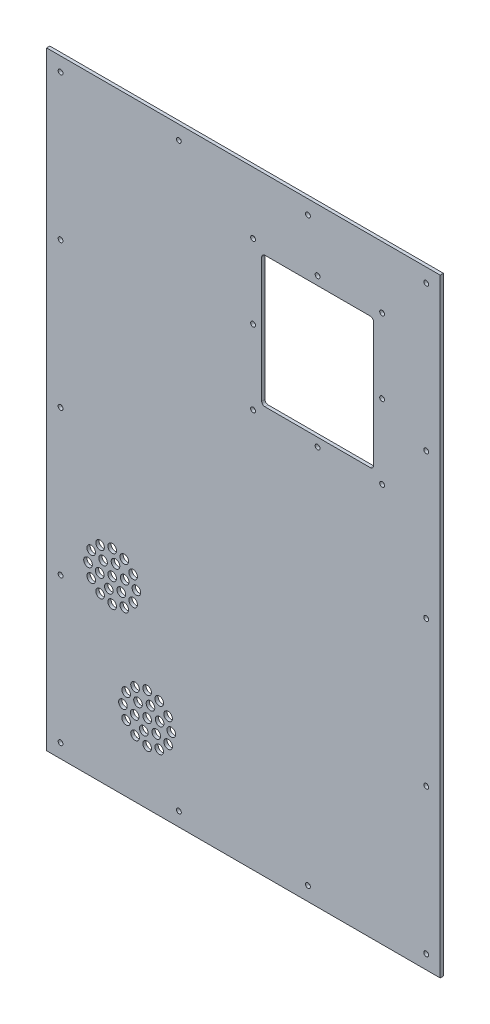
from build123d import *

# Parameters (mm, degrees)
SKETCH_1_W          = 366
SKETCH_1_H          = 566
EXTRUDE_1_DEPTH     = 3
SKETCH_5_R          = 2.25
CUT_EXTRUDE_2_DEPTH = 675.033381963
SKETCH_6_W          = 104
SKETCH_6_H          = 122
CUT_EXTRUDE_3_DEPTH = 675.033381963
SKETCH_7_R          = 2.25
CUT_EXTRUDE_4_DEPTH = 675.033381963
FILLET2_R           = 3
SKETCH_8_R          = 4
CUT_EXTRUDE_5_DEPTH = 675.033381963


with BuildPart() as part:
    # Эскиз1 → Бобышка-Вытянуть1 (new body)
    with BuildSketch(Plane.XY):
        with Locations((183, 283)):
            Rectangle(SKETCH_1_W, SKETCH_1_H)
    extrude(amount=EXTRUDE_1_DEPTH)

    # Эскиз5 → Вырез-Вытянуть2 (cut, through all)
    with BuildSketch(Plane(origin=(0, 0, 0), x_dir=(-1, 0, 0), z_dir=(0, 0, -1))):
        with Locations((-353, 553)):
            Circle(SKETCH_5_R)
        with Locations((-13, 553)):
            Circle(SKETCH_5_R)
        with Locations((-243, 553)):
            Circle(SKETCH_5_R)
        with Locations((-123, 553)):
            Circle(SKETCH_5_R)
        with Locations((-353, 418)):
            Circle(SKETCH_5_R)
        with Locations((-353, 283)):
            Circle(SKETCH_5_R)
        with Locations((-353, 148)):
            Circle(SKETCH_5_R)
        with Locations((-353, 13)):
            Circle(SKETCH_5_R)
        with Locations((-13, 418)):
            Circle(SKETCH_5_R)
        with Locations((-13, 283)):
            Circle(SKETCH_5_R)
        with Locations((-13, 148)):
            Circle(SKETCH_5_R)
        with Locations((-13, 13)):
            Circle(SKETCH_5_R)
        with Locations((-123, 13)):
            Circle(SKETCH_5_R)
        with Locations((-243, 13)):
            Circle(SKETCH_5_R)
    extrude(amount=-CUT_EXTRUDE_2_DEPTH, mode=Mode.SUBTRACT)

    # Эскиз6 → Вырез-Вытянуть3 (cut, through all)
    with BuildSketch(Plane.XY.offset(3)):
        with Locations((252, 439.5)):
            Rectangle(SKETCH_6_W, SKETCH_6_H)
    extrude(amount=-CUT_EXTRUDE_3_DEPTH, mode=Mode.SUBTRACT)

    # Эскиз7 → Вырез-Вытянуть4 (cut, through all)
    with BuildSketch(Plane.XY.offset(3)):
        with Locations((192, 370.5)):
            Circle(SKETCH_7_R)
        with Locations((192, 439.5)):
            Circle(SKETCH_7_R)
        with Locations((192, 508.5)):
            Circle(SKETCH_7_R)
        with Locations((252, 370.5)):
            Circle(SKETCH_7_R)
        with Locations((312, 370.5)):
            Circle(SKETCH_7_R)
        with Locations((252, 508.5)):
            Circle(SKETCH_7_R)
        with Locations((312, 508.5)):
            Circle(SKETCH_7_R)
        with Locations((312, 439.5)):
            Circle(SKETCH_7_R)
    extrude(amount=-CUT_EXTRUDE_4_DEPTH, mode=Mode.SUBTRACT)

    # Fillet2
    fillet2_edges = [part.edges().sort_by_distance(p)[0] for p in [
        (200, 378.5, 1.5),
        (304, 378.5, 1.5),
        (304, 500.5, 1.5),
        (200, 500.5, 1.5),
    ]]
    fillet(fillet2_edges, radius=FILLET2_R)

    # Эскиз8 → Вырез-Вытянуть5 (cut, through all)
    with BuildSketch(Plane(origin=(0, 0, 0), x_dir=(-1, 0, 0), z_dir=(0, 0, -1))):
        with Locations((-61, 148.5)):
            Circle(SKETCH_8_R)
        with Locations((-69.485281374, 162.514718626)):
            Circle(SKETCH_8_R)
        with Locations((-61, 171)):
            Circle(SKETCH_8_R)
        with Locations((-72.25, 151.514428415)):
            Circle(SKETCH_8_R)
        with Locations((-80.485571585, 159.75)):
            Circle(SKETCH_8_R)
        with Locations((-83.5, 171)):
            Circle(SKETCH_8_R)
        with Locations((-80.485571585, 182.25)):
            Circle(SKETCH_8_R)
        with Locations((-72.25, 190.485571585)):
            Circle(SKETCH_8_R)
        with Locations((-61, 193.5)):
            Circle(SKETCH_8_R)
        with Locations((-49.75, 190.485571585)):
            Circle(SKETCH_8_R)
        with Locations((-41.514428415, 182.25)):
            Circle(SKETCH_8_R)
        with Locations((-38.5, 171)):
            Circle(SKETCH_8_R)
        with Locations((-41.514428415, 159.75)):
            Circle(SKETCH_8_R)
        with Locations((-49.75, 151.514428415)):
            Circle(SKETCH_8_R)
        with Locations((-72.591109915, 174.105828541)):
            Circle(SKETCH_8_R)
        with Locations((-64.105828541, 182.591109915)):
            Circle(SKETCH_8_R)
        with Locations((-52.514718626, 179.485281374)):
            Circle(SKETCH_8_R)
        with Locations((-49.408890085, 167.894171459)):
            Circle(SKETCH_8_R)
        with Locations((-57.894171459, 159.408890085)):
            Circle(SKETCH_8_R)
        with Locations((-93.5, 73)):
            Circle(SKETCH_8_R)
        with Locations((-93.5, 50.5)):
            Circle(SKETCH_8_R)
        with Locations((-101.985281374, 64.514718626)):
            Circle(SKETCH_8_R)
        with Locations((-104.75, 53.514428415)):
            Circle(SKETCH_8_R)
        with Locations((-112.985571585, 61.75)):
            Circle(SKETCH_8_R)
        with Locations((-116, 73)):
            Circle(SKETCH_8_R)
        with Locations((-112.985571585, 84.25)):
            Circle(SKETCH_8_R)
        with Locations((-104.75, 92.485571585)):
            Circle(SKETCH_8_R)
        with Locations((-93.5, 95.5)):
            Circle(SKETCH_8_R)
        with Locations((-82.25, 92.485571585)):
            Circle(SKETCH_8_R)
        with Locations((-74.014428415, 84.25)):
            Circle(SKETCH_8_R)
        with Locations((-71, 73)):
            Circle(SKETCH_8_R)
        with Locations((-74.014428415, 61.75)):
            Circle(SKETCH_8_R)
        with Locations((-82.25, 53.514428415)):
            Circle(SKETCH_8_R)
        with Locations((-105.091109915, 76.105828541)):
            Circle(SKETCH_8_R)
        with Locations((-96.605828541, 84.591109915)):
            Circle(SKETCH_8_R)
        with Locations((-85.014718626, 81.485281374)):
            Circle(SKETCH_8_R)
        with Locations((-81.908890085, 69.894171459)):
            Circle(SKETCH_8_R)
        with Locations((-90.394171459, 61.408890085)):
            Circle(SKETCH_8_R)
    extrude(amount=-CUT_EXTRUDE_5_DEPTH, mode=Mode.SUBTRACT)


solid = part.part
